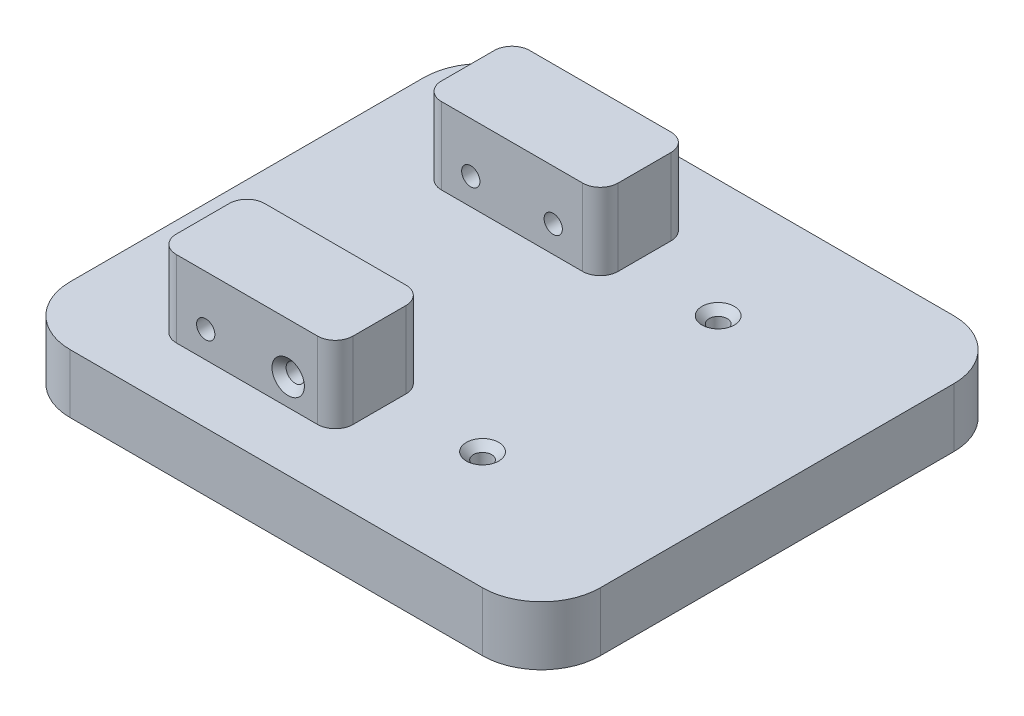
from build123d import *

# Parameters (mm, degrees)
SCHIZZO1_W                               = 90
SCHIZZO1_H                               = 80
ESTRUSIONE_ESTRUSIONE1_DEPTH             = 10
RACCORDO1_R                              = 10
FORO_SVASATO_PER_VITE_M2_5_1_D           = 3.1
FORO_SVASATO_PER_VITE_M2_5_1_CSINK_D     = 5.5
FORO_SVASATO_PER_VITE_M2_5_1_CSINK_ANGLE = 90
SCHIZZO4_W                               = 30
SCHIZZO4_H                               = 15
ESTRUSIONE_ESTRUSIONE2_DEPTH             = 13
FORO_PER_VITE_M2_5_1_D                   = 3.1
FORO_PER_VITE_M2_5_1_DEPTH               = 15
FORO_PER_VITE_M2_5_1_TIP                 = 0.931333959
FORO_PER_VITE_M2_5_2_D                   = 3.1
FORO_PER_VITE_M2_5_2_DEPTH               = 15
FORO_PER_VITE_M2_5_2_TIP                 = 0.931333959
FORO_SVASATO_PER_VITE_M2_5_2_D           = 3.1
FORO_SVASATO_PER_VITE_M2_5_2_DEPTH       = 15
FORO_SVASATO_PER_VITE_M2_5_2_CSINK_D     = 5.5
FORO_SVASATO_PER_VITE_M2_5_2_CSINK_ANGLE = 90
FORO_SVASATO_PER_VITE_M2_5_2_TIP         = 0.931333959
RACCORDO2_R                              = 3


with BuildPart() as part:
    # Schizzo1 → Estrusione-Estrusione1 (new body)
    with BuildSketch(Plane(origin=(0, 0, 0), x_dir=(1, 0, 0), z_dir=(0, 1, 0))):
        with Locations((-2.6, -4.4)):
            Rectangle(SCHIZZO1_W, SCHIZZO1_H)
    extrude(amount=ESTRUSIONE_ESTRUSIONE1_DEPTH)

    # Raccordo1
    raccordo1_edges = [part.edges().sort_by_distance(p)[0] for p in [
        (-47.6, 5, -35.6),
        (42.4, 5, -35.6),
        (-47.6, 5, 44.4),
        (42.4, 5, 44.4),
    ]]
    fillet(raccordo1_edges, radius=RACCORDO1_R)

    # Foro svasato per Vite M2.5-1 (through all)
    with Locations(Plane(origin=(12.4, 10, -15.6), x_dir=(0, 0, 1), z_dir=(0, 1, 0))):
        with Locations((0, 0), (40, 0)):
            CounterSinkHole(FORO_SVASATO_PER_VITE_M2_5_1_D / 2, FORO_SVASATO_PER_VITE_M2_5_1_CSINK_D / 2, counter_sink_angle=FORO_SVASATO_PER_VITE_M2_5_1_CSINK_ANGLE)

    # Schizzo4 → Estrusione-Estrusione2 (add)
    with BuildSketch(Plane(origin=(0, 10, 0), x_dir=(1, 0, 0), z_dir=(0, 1, 0))):
        with Locations((-17.6, 18.1)):
            Rectangle(SCHIZZO4_W, SCHIZZO4_H)
        with Locations((-17.6, -26.9)):
            Rectangle(SCHIZZO4_W, SCHIZZO4_H)
    extrude(amount=ESTRUSIONE_ESTRUSIONE2_DEPTH)

    # Foro per Vite M2.5-1
    with Locations(Plane(origin=(-24.6, 14.5, -25.6), x_dir=(-1, 0, 0), z_dir=(0, 0, -1))):
        with Locations((0, 0), (-14, 0)):
            Hole(FORO_PER_VITE_M2_5_1_D / 2, depth=FORO_PER_VITE_M2_5_1_DEPTH)
            with Locations((0, 0, -(FORO_PER_VITE_M2_5_1_DEPTH + FORO_PER_VITE_M2_5_1_TIP / 2))):  # 118° drill point
                Cone(0, FORO_PER_VITE_M2_5_1_D / 2, FORO_PER_VITE_M2_5_1_TIP, mode=Mode.SUBTRACT)

    # Foro per Vite M2.5-2
    with Locations(Plane(origin=(-24.6, 14.5, 34.4), x_dir=(1, 0, 0), z_dir=(0, 0, 1))):
        with Locations((0, 0)):
            Hole(FORO_PER_VITE_M2_5_2_D / 2, depth=FORO_PER_VITE_M2_5_2_DEPTH)
            with Locations((0, 0, -(FORO_PER_VITE_M2_5_2_DEPTH + FORO_PER_VITE_M2_5_2_TIP / 2))):  # 118° drill point
                Cone(0, FORO_PER_VITE_M2_5_2_D / 2, FORO_PER_VITE_M2_5_2_TIP, mode=Mode.SUBTRACT)

    # Foro svasato per Vite M2.5-2
    with Locations(Plane(origin=(-10.6, 14.5, 34.4), x_dir=(1, 0, 0), z_dir=(0, 0, 1))):
        with Locations((0, 0)):
            CounterSinkHole(FORO_SVASATO_PER_VITE_M2_5_2_D / 2, FORO_SVASATO_PER_VITE_M2_5_2_CSINK_D / 2, depth=FORO_SVASATO_PER_VITE_M2_5_2_DEPTH, counter_sink_angle=FORO_SVASATO_PER_VITE_M2_5_2_CSINK_ANGLE)
            with Locations((0, 0, -(FORO_SVASATO_PER_VITE_M2_5_2_DEPTH + FORO_SVASATO_PER_VITE_M2_5_2_TIP / 2))):  # 118° drill point
                Cone(0, FORO_SVASATO_PER_VITE_M2_5_2_D / 2, FORO_SVASATO_PER_VITE_M2_5_2_TIP, mode=Mode.SUBTRACT)

    # Raccordo2
    raccordo2_edges = [part.edges().sort_by_distance(p)[0] for p in [
        (-2.6, 16.5, -25.6),
        (-2.6, 16.5, -10.6),
        (-32.6, 16.5, -25.6),
        (-32.6, 16.5, -10.6),
        (-2.6, 16.5, 34.4),
        (-2.6, 16.5, 19.4),
        (-32.6, 16.5, 19.4),
        (-32.6, 16.5, 34.4),
    ]]
    fillet(raccordo2_edges, radius=RACCORDO2_R)


solid = part.part
